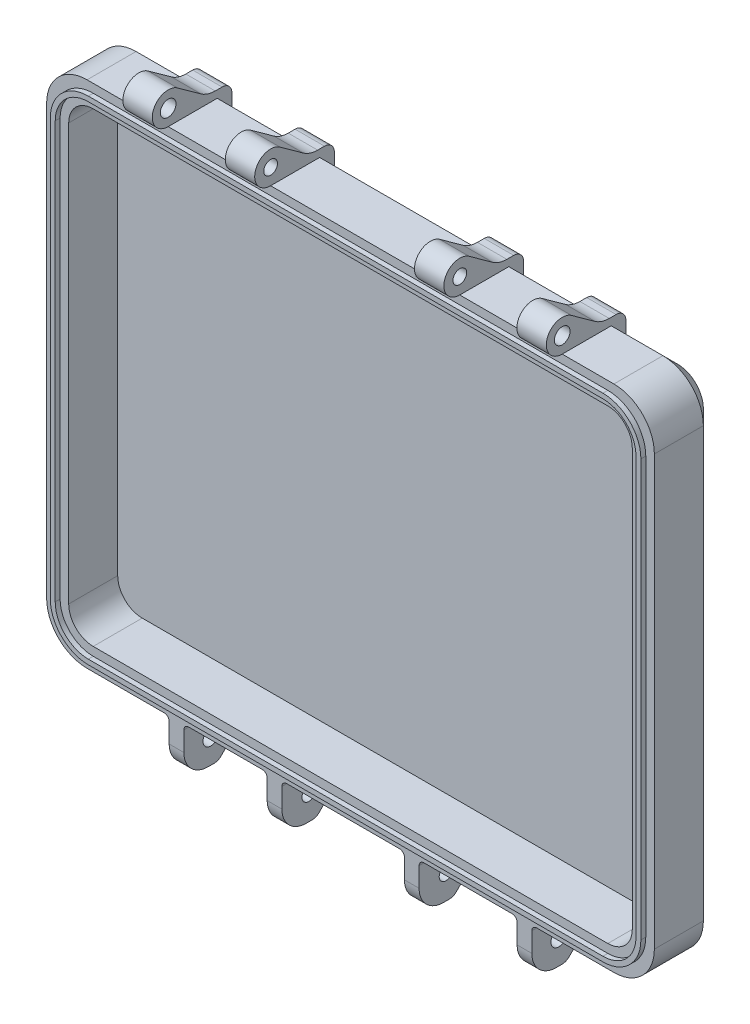
from build123d import *

# Parameters (mm, degrees)
SKETCH1_W            = 124
SKETCH1_H            = 104
SKETCH1_W_2          = 115
SKETCH1_H_2          = 95
BOSS_EXTRUDE1_DEPTH  = 10
SKETCH1_2_W          = 124
SKETCH1_2_H          = 104
BOSS_EXTRUDE2_DEPTH  = 3
FILLET1_R            = 8.25
FILLET2_R            = 5
BOSS_EXTRUDE3_DEPTH  = 1
CHAMFER1_SIZE        = 3
BOSS_EXTRUDE4_START  = -24.8
SKETCH3_R            = 1.6
BOSS_EXTRUDE4_DEPTH  = 6
BOSS_EXTRUDE5_START  = -105.2
SKETCH3_4_R          = 1.6
BOSS_EXTRUDE5_DEPTH  = 6
BOSS_EXTRUDE6_START  = -45.7
SKETCH3_6_R          = 1.4
BOSS_EXTRUDE6_DEPTH  = 6
BOSS_EXTRUDE7_START  = -84.3
SKETCH3_7_R          = 1.4
BOSS_EXTRUDE7_DEPTH  = 6
FILLET3_R            = 2
FILLET4_R            = 5
BOSS_EXTRUDE8_START  = -25
SKETCH4_R            = 1.6
BOSS_EXTRUDE8_DEPTH  = 3
BOSS_EXTRUDE9_START  = -96
SKETCH4_3_R          = 1.6
BOSS_EXTRUDE9_DEPTH  = 3
BOSS_EXTRUDE10_START = -48
SKETCH4_5_R          = 1.4
BOSS_EXTRUDE10_DEPTH = 3
BOSS_EXTRUDE11_START = -76
SKETCH4_6_R          = 1.4
BOSS_EXTRUDE11_DEPTH = 3
CHAMFER2_SIZE        = 6
FILLET5_R            = 5
FILLET6_R            = 2
FILLET7_R            = 1
FILLET8_R            = 4


with BuildPart() as part:
    # Sketch1 → Boss-Extrude1 (new body)
    with BuildSketch(Plane.XY):
        Rectangle(SKETCH1_W, SKETCH1_H)
        Rectangle(SKETCH1_W_2, SKETCH1_H_2, mode=Mode.SUBTRACT)
    extrude(amount=BOSS_EXTRUDE1_DEPTH)

    # Sketch1<2> → Boss-Extrude2 (add)
    with BuildSketch(Plane.XY):
        Rectangle(SKETCH1_2_W, SKETCH1_2_H)
    extrude(amount=-BOSS_EXTRUDE2_DEPTH)

    # Fillet1
    fillet1_edges = [part.edges().sort_by_distance(p)[0] for p in [
        (62, -52, 3.5),
        (-62, -52, 3.5),
        (-62, 52, 3.5),
        (62, 52, 3.5),
    ]]
    fillet(fillet1_edges, radius=FILLET1_R)

    # Fillet2
    fillet2_edges = [part.edges().sort_by_distance(p)[0] for p in [
        (57.5, -47.5, 5),
        (-57.5, 47.5, 5),
        (-57.5, -47.5, 5),
        (57.5, 47.5, 5),
    ]]
    fillet(fillet2_edges, radius=FILLET2_R)

    # Sketch2 → Boss-Extrude3 (add)
    with BuildSketch(Plane.XY.offset(10)):
        with BuildLine():
            Line((52.5, 50.25), (-52.5, 50.25))
            ThreePointArc((-52.5, 50.25), (-57.980077554, 47.980077554), (-60.25, 42.5))
            Line((-60.25, 42.5), (-60.25, -42.5))
            ThreePointArc((-60.25, -42.5), (-57.980077554, -47.980077554), (-52.5, -50.25))
            Line((-52.5, -50.25), (52.5, -50.25))
            ThreePointArc((52.5, -50.25), (57.980077554, -47.980077554), (60.25, -42.5))
            Line((60.25, -42.5), (60.25, 42.5))
            ThreePointArc((60.25, 42.5), (57.980077554, 47.980077554), (52.5, 50.25))
        make_face()
        with BuildLine():
            ThreePointArc((-59.25, 42.5), (-57.272970773, 47.272970773), (-52.5, 49.25))
            Line((-52.5, 49.25), (52.5, 49.25))
            ThreePointArc((52.5, 49.25), (57.272970773, 47.272970773), (59.25, 42.5))
            Line((59.25, 42.5), (59.25, -42.5))
            ThreePointArc((59.25, -42.5), (57.272970773, -47.272970773), (52.5, -49.25))
            Line((52.5, -49.25), (-52.5, -49.25))
            ThreePointArc((-52.5, -49.25), (-57.272970773, -47.272970773), (-59.25, -42.5))
            Line((-59.25, -42.5), (-59.25, 42.5))
        make_face(mode=Mode.SUBTRACT)
    extrude(amount=BOSS_EXTRUDE3_DEPTH)

    # Chamfer1
    chamfer1_edges = [part.edges().sort_by_distance(p)[0] for p in [
        (0, -52, -3),
        (59.583630945, -49.583630945, -3),
        (-59.583630945, -49.583630945, -3),
        (62, 0, -3),
        (-62, 0, -3),
        (59.583630945, 49.583630945, -3),
        (-59.583630945, 49.583630945, -3),
        (0, 52, -3),
    ]]
    chamfer(chamfer1_edges, length=CHAMFER1_SIZE)

    # Sketch3 → Boss-Extrude4 (add)
    with BuildSketch(Plane.ZY.offset(62).offset(BOSS_EXTRUDE4_START)):
        with BuildLine():
            Line((0, 52), (10, 52))
            ThreePointArc((10, 52), (13.092758443, 56.248671724), (8.099292057, 57.8862491))
            Line((8.099292057, 57.8862491), (2.015640289, 53.5))
            Line((2.015640289, 53.5), (-3, 53.5))
            Line((-3, 53.5), (-3, 49))
            Line((-3, 49), (0, 52))
        make_face()
        with Locations((10, 55.25)):
            Circle(SKETCH3_R, mode=Mode.SUBTRACT)
    extrude(amount=BOSS_EXTRUDE4_DEPTH)

    # Sketch3<4> → Boss-Extrude5 (add)
    with BuildSketch(Plane.ZY.offset(62).offset(BOSS_EXTRUDE5_START)):
        with BuildLine():
            Line((0, 52), (10, 52))
            ThreePointArc((10, 52), (13.092758443, 56.248671724), (8.099292057, 57.8862491))
            Line((8.099292057, 57.8862491), (2.015640289, 53.5))
            Line((2.015640289, 53.5), (-3, 53.5))
            Line((-3, 53.5), (-3, 49))
            Line((-3, 49), (0, 52))
        make_face()
        with Locations((10, 55.25)):
            Circle(SKETCH3_4_R, mode=Mode.SUBTRACT)
    extrude(amount=BOSS_EXTRUDE5_DEPTH)

    # Sketch3<6> → Boss-Extrude6 (add)
    with BuildSketch(Plane.ZY.offset(62).offset(BOSS_EXTRUDE6_START)):
        with BuildLine():
            Line((0, 52), (10, 52))
            ThreePointArc((10, 52), (13.092758443, 56.248671724), (8.099292057, 57.8862491))
            Line((8.099292057, 57.8862491), (2.015640289, 53.5))
            Line((2.015640289, 53.5), (-3, 53.5))
            Line((-3, 53.5), (-3, 49))
            Line((-3, 49), (0, 52))
        make_face()
        with Locations((10, 55.25)):
            Circle(SKETCH3_6_R, mode=Mode.SUBTRACT)
    extrude(amount=BOSS_EXTRUDE6_DEPTH)

    # Sketch3<7> → Boss-Extrude7 (add)
    with BuildSketch(Plane.ZY.offset(62).offset(BOSS_EXTRUDE7_START)):
        with BuildLine():
            Line((0, 52), (10, 52))
            ThreePointArc((10, 52), (13.092758443, 56.248671724), (8.099292057, 57.8862491))
            Line((8.099292057, 57.8862491), (2.015640289, 53.5))
            Line((2.015640289, 53.5), (-3, 53.5))
            Line((-3, 53.5), (-3, 49))
            Line((-3, 49), (0, 52))
        make_face()
        with Locations((10, 55.25)):
            Circle(SKETCH3_7_R, mode=Mode.SUBTRACT)
    extrude(amount=BOSS_EXTRUDE7_DEPTH)

    # Fillet3
    fillet3_edges = [part.edges().sort_by_distance(p)[0] for p in [
        (-40.2, 53.5, -3),
        (-19.3, 53.5, -3),
        (19.3, 53.5, -3),
        (40.2, 53.5, -3),
    ]]
    fillet(fillet3_edges, radius=FILLET3_R)

    # Fillet4
    fillet4_edges = [part.edges().sort_by_distance(p)[0] for p in [
        (-40.2, 53.5, 2.015640289),
        (-19.3, 53.5, 2.015640289),
        (19.3, 53.5, 2.015640289),
        (40.2, 53.5, 2.015640289),
    ]]
    fillet(fillet4_edges, radius=FILLET4_R)

    # Sketch4 → Boss-Extrude8 (add)
    with BuildSketch(Plane(origin=(62, 0, 0), x_dir=(0, 0, -1), z_dir=(1, 0, 0)).offset(BOSS_EXTRUDE8_START)):
        Polygon((3, -49), (0, -52), (-10, -52), (-10, -62), (3, -62), align=None)
        with Locations((-4.5, -57)):
            Circle(SKETCH4_R, mode=Mode.SUBTRACT)
    extrude(amount=-BOSS_EXTRUDE8_DEPTH)

    # Sketch4<3> → Boss-Extrude9 (add)
    with BuildSketch(Plane(origin=(62, 0, 0), x_dir=(0, 0, -1), z_dir=(1, 0, 0)).offset(BOSS_EXTRUDE9_START)):
        Polygon((3, -49), (0, -52), (-10, -52), (-10, -62), (3, -62), align=None)
        with Locations((-4.5, -57)):
            Circle(SKETCH4_3_R, mode=Mode.SUBTRACT)
    extrude(amount=-BOSS_EXTRUDE9_DEPTH)

    # Sketch4<5> → Boss-Extrude10 (add)
    with BuildSketch(Plane(origin=(62, 0, 0), x_dir=(0, 0, -1), z_dir=(1, 0, 0)).offset(BOSS_EXTRUDE10_START)):
        Polygon((3, -49), (0, -52), (-10, -52), (-10, -62), (3, -62), align=None)
        with Locations((-4.5, -57)):
            Circle(SKETCH4_5_R, mode=Mode.SUBTRACT)
    extrude(amount=-BOSS_EXTRUDE10_DEPTH)

    # Sketch4<6> → Boss-Extrude11 (add)
    with BuildSketch(Plane(origin=(62, 0, 0), x_dir=(0, 0, -1), z_dir=(1, 0, 0)).offset(BOSS_EXTRUDE11_START)):
        Polygon((3, -49), (0, -52), (-10, -52), (-10, -62), (3, -62), align=None)
        with Locations((-4.5, -57)):
            Circle(SKETCH4_6_R, mode=Mode.SUBTRACT)
    extrude(amount=-BOSS_EXTRUDE11_DEPTH)

    # Chamfer2
    chamfer2_edges = [part.edges().sort_by_distance(p)[0] for p in [
        (-35.5, -62, -3),
        (-15.5, -62, -3),
        (12.5, -62, -3),
        (35.5, -62, -3),
    ]]
    chamfer(chamfer2_edges, length=CHAMFER2_SIZE)

    # Fillet5
    fillet5_edges = [part.edges().sort_by_distance(p)[0] for p in [
        (-35.5, -62, 10),
        (-15.5, -62, 10),
        (12.5, -62, 10),
        (35.5, -62, 10),
    ]]
    fillet(fillet5_edges, radius=FILLET5_R)

    # Fillet6
    fillet6_edges = [part.edges().sort_by_distance(p)[0] for p in [
        (35.5, -62, 3),
        (12.5, -62, 3),
        (-15.5, -62, 3),
        (-35.5, -62, 3),
    ]]
    fillet(fillet6_edges, radius=FILLET6_R)

    # Fillet7
    fillet7_edges = [part.edges().sort_by_distance(p)[0] for p in [
        (-34, -52, 5),
        (-34, -50.5, -1.5),
        (-37, -52, 5),
        (-37, -50.5, -1.5),
        (-17, -52, 5),
        (-17, -50.5, -1.5),
        (-14, -50.5, -1.5),
        (-14, -52, 5),
        (11, -52, 5),
        (11, -50.5, -1.5),
        (14, -52, 5),
        (14, -50.5, -1.5),
        (34, -52, 5),
        (34, -50.5, -1.5),
        (37, -50.5, -1.5),
        (37, -52, 5),
    ]]
    fillet(fillet7_edges, radius=FILLET7_R)

    # Fillet8
    fillet8_edges = [part.edges().sort_by_distance(p)[0] for p in [
        (35.5, -56, -3),
        (12.5, -56, -3),
        (-15.5, -56, -3),
        (-35.5, -56, -3),
    ]]
    fillet(fillet8_edges, radius=FILLET8_R)


solid = part.part
